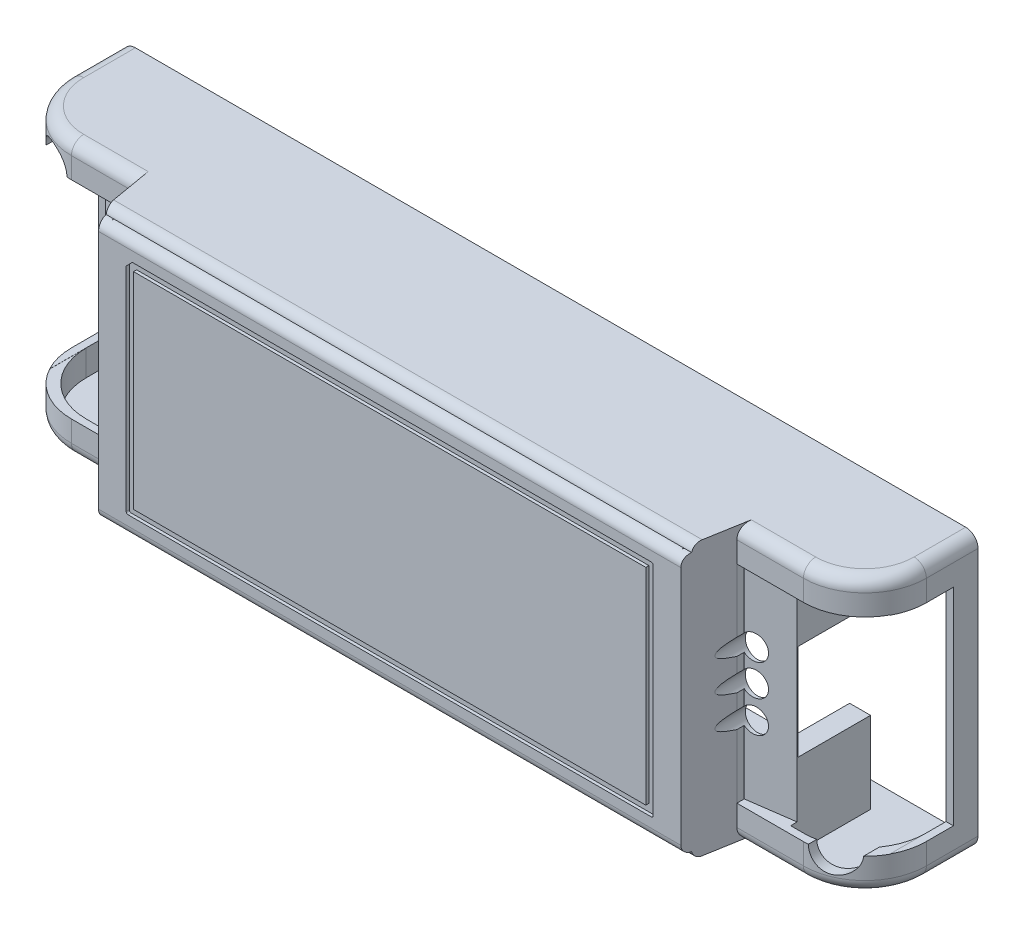
from build123d import *

# Parameters (mm, degrees)
SKETCH1_W           = 69.545
SKETCH1_H           = 44.53
BOSS_EXTRUDE1_DEPTH = 26.17
SKETCH2_W           = 20.83
SKETCH2_H           = 44.53
CUT_EXTRUDE1_DEPTH  = 7.77
CUT_EXTRUDE2_DEPTH  = 63.264890237
SKETCH4_W           = 49.937118806
SKETCH4_H           = 33.7
CUT_EXTRUDE3_DEPTH  = 1.2
SKETCH5_W           = 12.08
SKETCH5_H           = 33.7
CUT_EXTRUDE4_DEPTH  = 46.204169954
SKETCH6_W           = 6.22
SKETCH6_H           = 33.63
CUT_EXTRUDE5_DEPTH  = 1.2
SKETCH8_W           = 8.18
SKETCH8_H           = 33.63
CUT_EXTRUDE6_DEPTH  = 1.2
SKETCH9_W           = 4.2
SKETCH9_H           = 33.7
CUT_EXTRUDE7_DEPTH  = 5
SKETCH11_W          = 11.8
SKETCH11_H          = 15.6
CUT_EXTRUDE8_DEPTH  = 5
CUT_EXTRUDE9_DEPTH  = 4.2
CUT_EXTRUDE10_DEPTH = 4.2
SHELL3_START        = -21.065
SHELL3_DEPTH        = 42.13
SHELL3_2_OUTLINE_W  = 5
SHELL3_2_OUTLINE_H  = 10.6
SHELL3_2_DEPTH      = 12.08
SHELL3_START_2      = 9.015
SHELL3_3_OUTLINE_W  = 5
SHELL3_3_OUTLINE_H  = 10.6
SHELL3_3_DEPTH      = 12.05
SHELL3_4_DEPTH      = 3.03
SHELL3_START_3      = 18.065
SHELL3_5_DEPTH      = 3
SKETCH15_W          = 24.97
SKETCH15_H          = 42.13
CUT_EXTRUDE11_DEPTH = 4.2
CUT_EXTRUDE12_DEPTH = 4.2
SKETCH18_W          = 5
SKETCH18_H          = 12.05
CUT_EXTRUDE13_DEPTH = 4.2
SKETCH19_W          = 46.355516444
SKETCH19_H          = 1.5
BOSS_EXTRUDE2_DEPTH = 2.5
SKETCH22_W          = 49.678335722
SKETCH22_H          = 1.2
CUT_EXTRUDE16_DEPTH = 1.5
SKETCH23_W          = 1.5
SKETCH23_H          = 1.2
CUT_EXTRUDE17_DEPTH = 1.5
SKETCH24_W          = 47.365
SKETCH24_H          = 1.2
CUT_EXTRUDE18_DEPTH = 1.5
SKETCH25_W          = 1.5
SKETCH25_H          = 1.2
CUT_EXTRUDE19_DEPTH = 1.5
CUT_EXTRUDE20_DEPTH = 0.5
FILLET1_R           = 1.5
FILLET5_R           = 10
FILLET6_R           = 10
FILLET7_R           = 2
SKETCH27_W          = 3.013383432
SKETCH27_H          = 1.2
CUT_EXTRUDE21_DEPTH = 11.8
SKETCH28_W          = 2.79766396
SKETCH28_H          = 1.2
CUT_EXTRUDE22_DEPTH = 11.8
SKETCH29_W          = 5.34766396
SKETCH29_H          = 15.645548361
CUT_EXTRUDE23_DEPTH = 0.5
SKETCH30_R          = 2
CUT_EXTRUDE24_DEPTH = 108.935726486
SKETCH31_W          = 5.563383432
SKETCH31_H          = 15.653597394
CUT_EXTRUDE25_DEPTH = 0.5
SKETCH32_R          = 2
CUT_EXTRUDE26_DEPTH = 108.935726486
CHAMFER2_SIZE       = 1
FILLET8_R           = 0.3
SKETCH33_R          = 3.09
CUT_EXTRUDE27_DEPTH = 109.242464182
SKETCH34_R          = 3.09
CUT_EXTRUDE28_DEPTH = 109.242464182
CHAMFER6_SIZE       = 7.5
CHAMFER6_SIZE_2     = 1.05405626
SKETCH35_W          = 6.5
SKETCH35_H          = 2
CUT_EXTRUDE29_DEPTH = 0.5
CHAMFER7_SIZE       = 0.5
CHAMFER8_SIZE       = 0.5


# Read off the part's stored shape, not the designer's step: Shell3
# Some blends are built 0.0001 mm under size
with BuildPart() as part:
    # Sketch1 → Boss-Extrude1 (new body)
    with BuildSketch(Plane.XY):
        Rectangle(SKETCH1_W, SKETCH1_H)
    extrude(amount=BOSS_EXTRUDE1_DEPTH)

    # Sketch2 → Cut-Extrude1 (cut)
    with BuildSketch(Plane.XY.offset(26.17)):
        with Locations((24.3575, 0)):
            Rectangle(SKETCH2_W, SKETCH2_H)
    extrude(amount=-CUT_EXTRUDE1_DEPTH, mode=Mode.SUBTRACT)

    # Sketch3 → Cut-Extrude2 (cut, through all)
    with BuildSketch(Plane.XZ.offset(22.265)):
        Polygon((13.9425, 18.4), (13.9425, 26.17), (12.5925, 26.17), align=None)
    extrude(amount=-CUT_EXTRUDE2_DEPTH, mode=Mode.SUBTRACT)

    # Sketch4 → Cut-Extrude3 (cut)
    with BuildSketch(Plane.XY.offset(18.4)):
        with Locations((38.911059403, 0.015)):
            Rectangle(SKETCH4_W, SKETCH4_H)
    extrude(amount=-CUT_EXTRUDE3_DEPTH, mode=Mode.SUBTRACT)

    # Sketch5 → Cut-Extrude4 (cut, through all)
    with BuildSketch(Plane.XY.offset(18.4)):
        with Locations((27.5325, 0.015)):
            Rectangle(SKETCH5_W, SKETCH5_H)
    extrude(amount=-CUT_EXTRUDE4_DEPTH, mode=Mode.SUBTRACT)

    # Sketch6 → Cut-Extrude5 (cut)
    with BuildSketch(Plane(origin=(34.7725, 0, 0), x_dir=(0, 0, -1), z_dir=(1, 0, 0))):
        with Locations((-7.11, 0)):
            Rectangle(SKETCH6_W, SKETCH6_H)
    extrude(amount=-CUT_EXTRUDE5_DEPTH, mode=Mode.SUBTRACT)

    # Sketch8 → Cut-Extrude6 (cut)
    with BuildSketch(Plane(origin=(34.7725, 0, 0), x_dir=(0, 0, -1), z_dir=(1, 0, 0))):
        with Locations((-14.31, 0)):
            Rectangle(SKETCH8_W, SKETCH8_H)
    extrude(amount=-CUT_EXTRUDE6_DEPTH, mode=Mode.SUBTRACT)

    # Sketch9 → Cut-Extrude7 (cut)
    with BuildSketch(Plane(origin=(21.4925, 0, 0), x_dir=(0, 0, -1), z_dir=(1, 0, 0))):
        with Locations((-2.1, 0.015)):
            Rectangle(SKETCH9_W, SKETCH9_H)
    extrude(amount=-CUT_EXTRUDE7_DEPTH, mode=Mode.SUBTRACT)

    # Sketch11 → Cut-Extrude8 (cut)
    with BuildSketch(Plane(origin=(21.4925, 0, 0), x_dir=(0, 0, -1), z_dir=(1, 0, 0))):
        with Locations((-10.1, 0.015)):
            Rectangle(SKETCH11_W, SKETCH11_H)
    extrude(amount=-CUT_EXTRUDE8_DEPTH, mode=Mode.SUBTRACT)

    # Sketch13 → Cut-Extrude9 (cut)
    with BuildSketch(Plane.XZ.offset(-16.865)):
        Polygon((33.5725, 17.2), (21.4925, 17.2), (21.4925, 4.2), (16.4925, 4.2), (16.4925, 0), (33.5725, 0), align=None)
    extrude(amount=-CUT_EXTRUDE9_DEPTH, mode=Mode.SUBTRACT)

    # Sketch14 → Cut-Extrude10 (cut)
    with BuildSketch(Plane(origin=(0, -16.835, 0), x_dir=(1, 0, 0), z_dir=(0, 1, 0))):
        Polygon((33.5725, -17.2), (21.4925, -17.2), (21.4925, -4.2), (16.4925, -4.2), (16.4925, 0), (33.5725, 0), align=None)
    extrude(amount=-CUT_EXTRUDE10_DEPTH, mode=Mode.SUBTRACT)

    # Shell3 outline → Shell3 (cut)
    with BuildSketch(Plane(origin=(0, 0, 0), x_dir=(1, 0, 0), z_dir=(0, 1, 0)).offset(SHELL3_START)):
        Polygon((12.7425, -16), (15.2925, -16), (15.2925, 0), (-33.5725, 0), (-33.5725, -24.97), (11.583016444, -24.97), (12.7425, -18.296527977), align=None)
    extrude(amount=SHELL3_DEPTH, mode=Mode.SUBTRACT)

    # Shell3 2 outline → Shell3 2 (cut)
    with BuildSketch(Plane(origin=(0, 0, 0), x_dir=(1, 0, 0), z_dir=(0, 1, 0)).offset(SHELL3_START)):
        with Locations((17.7925, -10.7)):
            Rectangle(SHELL3_2_OUTLINE_W, SHELL3_2_OUTLINE_H)
    extrude(amount=SHELL3_2_DEPTH, mode=Mode.SUBTRACT)

    # Shell3 3 outline → Shell3 3 (cut)
    with BuildSketch(Plane(origin=(0, 0, 0), x_dir=(1, 0, 0), z_dir=(0, 1, 0)).offset(SHELL3_START_2)):
        with Locations((17.7925, -10.7)):
            Rectangle(SHELL3_3_OUTLINE_W, SHELL3_3_OUTLINE_H)
    extrude(amount=SHELL3_3_DEPTH, mode=Mode.SUBTRACT)

    # Shell3 4 outline → Shell3 4 (cut)
    with BuildSketch(Plane(origin=(0, 0, 0), x_dir=(1, 0, 0), z_dir=(0, 1, 0)).offset(SHELL3_START)):
        Polygon((20.2925, -17.2), (20.2925, -16), (12.7425, -16), (12.7425, -18.296527977), (12.933016444, -17.2), align=None)
    extrude(amount=SHELL3_4_DEPTH, mode=Mode.SUBTRACT)

    # Shell3 5 outline → Shell3 5 (cut)
    with BuildSketch(Plane(origin=(0, 0, 0), x_dir=(1, 0, 0), z_dir=(0, 1, 0)).offset(SHELL3_START_3)):
        Polygon((20.2925, -17.2), (20.2925, -16), (12.7425, -16), (12.7425, -18.296527977), (12.933016444, -17.2), align=None)
    extrude(amount=SHELL3_5_DEPTH, mode=Mode.SUBTRACT)

    # Sketch15 → Cut-Extrude11 (cut)
    with BuildSketch(Plane.ZY.offset(34.7725)):
        with Locations((12.485, 0)):
            Rectangle(SKETCH15_W, SKETCH15_H)
    extrude(amount=-CUT_EXTRUDE11_DEPTH, mode=Mode.SUBTRACT)

    # Sketch16 → Cut-Extrude12 (cut)
    with BuildSketch(Plane(origin=(16.4925, 0, 0), x_dir=(0, 0, -1), z_dir=(1, 0, 0))):
        Polygon((-16, -7.785), (-4.2, -7.785), (-4.2, -21.035), (0, -21.035), (0, 21.065), (-4.2, 21.065), (-4.2, 7.815), (-16, 7.815), align=None)
    extrude(amount=-CUT_EXTRUDE12_DEPTH, mode=Mode.SUBTRACT)

    # Sketch18 → Cut-Extrude13 (cut)
    with BuildSketch(Plane(origin=(0, 0, 4.2), x_dir=(-1, 0, 0), z_dir=(0, 0, -1))):
        with Locations((-17.7925, 15.04)):
            Rectangle(SKETCH18_W, SKETCH18_H)
        with Locations((-17.7925, -15.01)):
            Rectangle(SKETCH18_W, SKETCH18_H)
    extrude(amount=-CUT_EXTRUDE13_DEPTH, mode=Mode.SUBTRACT)

    # Sketch19 → Boss-Extrude2 (add)
    with BuildSketch(Plane(origin=(0, 0, 24.97), x_dir=(-1, 0, 0), z_dir=(0, 0, -1))):
        with Locations((11.594741778, -20.315)):
            Rectangle(SKETCH19_W, SKETCH19_H)
        with Locations((11.594741778, 20.315)):
            Rectangle(SKETCH19_W, SKETCH19_H)
    extrude(amount=BOSS_EXTRUDE2_DEPTH)

    # Sketch22 → Cut-Extrude16 (cut)
    with BuildSketch(Plane.XY.offset(26.17)):
        with Locations((-12.246667861, -21.665)):
            Rectangle(SKETCH22_W, SKETCH22_H)
    extrude(amount=-CUT_EXTRUDE16_DEPTH, mode=Mode.SUBTRACT)

    # Sketch23 → Cut-Extrude17 (cut)
    with BuildSketch(Plane.ZY.offset(-12.5925)):
        with Locations((25.42, -21.665)):
            Rectangle(SKETCH23_W, SKETCH23_H)
    extrude(amount=-CUT_EXTRUDE17_DEPTH, mode=Mode.SUBTRACT)

    # Sketch24 → Cut-Extrude18 (cut)
    with BuildSketch(Plane.XY.offset(26.17)):
        with Locations((-11.09, 21.665)):
            Rectangle(SKETCH24_W, SKETCH24_H)
    extrude(amount=-CUT_EXTRUDE18_DEPTH, mode=Mode.SUBTRACT)

    # Sketch25 → Cut-Extrude19 (cut)
    with BuildSketch(Plane.ZY.offset(-12.5925)):
        with Locations((25.42, 21.665)):
            Rectangle(SKETCH25_W, SKETCH25_H)
    extrude(amount=-CUT_EXTRUDE19_DEPTH, mode=Mode.SUBTRACT)

    # Sketch26 → Cut-Extrude20 (cut)
    with BuildSketch(Plane.XY.offset(26.17)):
        Polygon((8.0925, -17.955), (8.0925, 17.951908527), (-34.7725, 17.951908527), (-34.7725, 16.751908527), (6.8925, 16.751908527), (6.8925, -16.755), (-34.7725, -16.755), (-34.7725, -17.955), align=None)
    extrude(amount=-CUT_EXTRUDE20_DEPTH, mode=Mode.SUBTRACT)

    # Fillet1
    # the kernel refuses this fillet: 1.5 mm, written as the material it takes off along each edge
    with BuildSketch(Plane(origin=(16.3425, 21.065, 26.17), x_dir=(0, 0, -1), z_dir=(-1, 0, 0))) as fillet1_piece_1:
        with BuildLine():
            CenterArc((FILLET1_R, FILLET1_R), FILLET1_R, 180, 90)
            Line((0, FILLET1_R), (-FILLET1_R * 0.02, FILLET1_R))
            Line((-FILLET1_R * 0.02, FILLET1_R), (-FILLET1_R * 0.02, -FILLET1_R * 0.02))
            Line((-FILLET1_R * 0.02, -FILLET1_R * 0.02), (FILLET1_R, -FILLET1_R * 0.02))
            Line((FILLET1_R, -FILLET1_R * 0.02), (FILLET1_R, 0))
        make_face()
    extrude(amount=54.865, mode=Mode.SUBTRACT)
    with BuildSketch(Plane(origin=(-38.446734614, 22.265, 24.67), x_dir=(0, 0, -1), z_dir=(1, 0, 0)), Plane(origin=(16.527352375, -22.265, 24.67), x_dir=(0, 0, -1), z_dir=(-1, 0, 0))) as fillet1_piece_2:
        with BuildLine():
            CenterArc((1.469693846, -1.5), FILLET1_R, 90, 78.463040967)
            Line((0, -1.2), (-0.029393877, -1.194))
            ThreePointArc((-0.029393877, -1.194), (-0.03, -0.6), (-0.03, 0))
            Line((-0.03, 0), (0, 0.03))
            Line((0, 0.03), (1.469693846, 0.03))
            Line((1.469693846, 0.03), (1.469693846, 0))
        make_face()
    extrude(amount=54.974086989, mode=Mode.SUBTRACT)
    with BuildSketch(Plane(origin=(-38.5225, -21.065, 26.17), x_dir=(0, 1, 0), z_dir=(1, 0, 0))) as fillet1_piece_3:
        with BuildLine():
            CenterArc((FILLET1_R, -FILLET1_R), FILLET1_R, 90, 90)
            Line((0, -FILLET1_R), (-FILLET1_R * 0.02, -FILLET1_R))
            Line((-FILLET1_R * 0.02, -FILLET1_R), (-FILLET1_R * 0.02, FILLET1_R * 0.02))
            Line((-FILLET1_R * 0.02, FILLET1_R * 0.02), (FILLET1_R, FILLET1_R * 0.02))
            Line((FILLET1_R, FILLET1_R * 0.02), (FILLET1_R, 0))
        make_face()
    extrude(amount=54.865, mode=Mode.SUBTRACT)

    # Fillet5
    fillet5_edges = [part.edges().sort_by_distance(p)[0] for p in [
        (33.5725, 18.965, 17.2),
        (33.5725, -18.935, 17.2),
    ]]
    fillet(fillet5_edges, radius=FILLET5_R)

    # Fillet6
    # the kernel refuses this fillet: 10 mm, written as the material it takes off along each edge
    with BuildSketch(Plane(origin=(34.7725, -47.265, 18.4), x_dir=(0, 0, -1), z_dir=(0, 1, 0))) as fillet6_piece_1:
        with BuildLine():
            CenterArc((FILLET6_R, FILLET6_R), FILLET6_R, 180, 90)
            Line((0, FILLET6_R), (0, 0))
            Line((0, 0), (FILLET6_R, 0))
        make_face()
    extrude(amount=55.43, mode=Mode.SUBTRACT)
    with BuildSketch(Plane(origin=(34.7725, -8.135, 18.4), x_dir=(0, 0, -1), z_dir=(0, 1, 0))) as fillet6_piece_2:
        with BuildLine():
            CenterArc((FILLET6_R, FILLET6_R), FILLET6_R, 180, 90)
            Line((0, FILLET6_R), (0, 0))
            Line((0, 0), (FILLET6_R, 0))
        make_face()
    extrude(amount=55.4, mode=Mode.SUBTRACT)

    # Fillet7
    fillet7_edges = [part.edges().sort_by_distance(p)[0] for p in [
        (19.3575, -22.265, 18.4),
        (34.7725, -22.265, 4.2),
        (34.7725, 22.265, 4.2),
        (31.843567812, -22.265, 15.471067812),
        (19.3575, 22.265, 18.4),
        (31.843567812, 22.265, 15.471067812),
    ]]
    fillet(fillet7_edges, radius=FILLET7_R)

    # Mirror1: part across plane


with BuildPart() as part_1:
    add(part.part)
    add(part.part.mirror(Plane(origin=(-34.7725, 22.265, 26.17), x_dir=(0, 0, 1), z_dir=(1, 0, 0))))

    # Sketch27 → Cut-Extrude21 (cut)
    with BuildSketch(Plane(origin=(0, 0, 4.2), x_dir=(-1, 0, 0), z_dir=(0, 0, -1))):
        with Locations((86.344191716, 8.415)):
            Rectangle(SKETCH27_W, SKETCH27_H)
        with Locations((86.344191716, -8.385)):
            Rectangle(SKETCH27_W, SKETCH27_H)
    extrude(amount=-CUT_EXTRUDE21_DEPTH, mode=Mode.SUBTRACT)

    # Sketch28 → Cut-Extrude22 (cut)
    with BuildSketch(Plane(origin=(0, 0, 4.2), x_dir=(-1, 0, 0), z_dir=(0, 0, -1))):
        with Locations((-16.69133198, -8.385)):
            Rectangle(SKETCH28_W, SKETCH28_H)
        with Locations((-16.69133198, 8.415)):
            Rectangle(SKETCH28_W, SKETCH28_H)
    extrude(amount=-CUT_EXTRUDE22_DEPTH, mode=Mode.SUBTRACT)

    # Sketch29 → Cut-Extrude23 (cut)
    with BuildSketch(Plane(origin=(0, 0, 16), x_dir=(-1, 0, 0), z_dir=(0, 0, -1))):
        with Locations((-15.41633198, 0.037774181)):
            Rectangle(SKETCH29_W, SKETCH29_H)
    extrude(amount=-CUT_EXTRUDE23_DEPTH, mode=Mode.SUBTRACT)

    # Sketch30 → Cut-Extrude24 (cut, through all)
    with BuildSketch(Plane(origin=(0, 0, 16.5), x_dir=(-1, 0, 0), z_dir=(0, 0, -1))):
        with Locations((-15.4125, -5.115)):
            Circle(SKETCH30_R)
        with Locations((-15.4125, 0.060548361)):
            Circle(SKETCH30_R)
        with Locations((-15.4125, 5.190548361)):
            Circle(SKETCH30_R)
    extrude(amount=-CUT_EXTRUDE24_DEPTH, mode=Mode.SUBTRACT)

    # Sketch31 → Cut-Extrude25 (cut)
    with BuildSketch(Plane(origin=(0, 0, 16), x_dir=(-1, 0, 0), z_dir=(0, 0, -1))):
        with Locations((85.069191716, 0.041798697)):
            Rectangle(SKETCH31_W, SKETCH31_H)
    extrude(amount=-CUT_EXTRUDE25_DEPTH, mode=Mode.SUBTRACT)

    # Sketch32 → Cut-Extrude26 (cut, through all)
    with BuildSketch(Plane(origin=(0, 0, 16.5), x_dir=(-1, 0, 0), z_dir=(0, 0, -1))):
        with Locations((84.990163266, -4.596818662)):
            Circle(SKETCH32_R)
        with Locations((84.990163266, 4.748597394)):
            Circle(SKETCH32_R)
    extrude(amount=-CUT_EXTRUDE26_DEPTH, mode=Mode.SUBTRACT)

    # Chamfer2
    chamfer2_edges = [part_1.edges().sort_by_distance(p)[0] for p in [
        (-77.6375, 17.951908527, 25.92),
    ]]
    chamfer(chamfer2_edges, length=CHAMFER2_SIZE)

    # Fillet8
    fillet8_edges = [part_1.edges().sort_by_distance(p)[0] for p in [
        (8.0925, 17.951908527, 25.92),
        (8.0925, -17.955, 25.92),
        (-77.6375, -17.955, 25.92),
    ]]
    fillet(fillet8_edges, radius=FILLET8_R)

    # Sketch33 → Cut-Extrude27 (cut, through all)
    with BuildSketch(Plane.XY.offset(18.4)):
        with Locations((-98.1775, 16.865)):
            Circle(SKETCH33_R)
    extrude(amount=-CUT_EXTRUDE27_DEPTH, mode=Mode.SUBTRACT)

    # Sketch34 → Cut-Extrude28 (cut, through all)
    with BuildSketch(Plane.XY.offset(18.4)):
        with Locations((28.6325, -16.835)):
            Circle(SKETCH34_R)
    extrude(amount=-CUT_EXTRUDE28_DEPTH, mode=Mode.SUBTRACT)

    # Chamfer5
    # the kernel refuses this chamfer: 7.5, 1.05405626 mm, written as the material it takes off along each edge
    with BuildSketch(Plane(origin=(21.4925, 16.865, 17.2), x_dir=(-0.9999856632816031, 0, 0.005354739139527623), z_dir=(0, -1, 0))) as chamfer5_piece_1_section:
        with BuildLine():
            Line((7.797192207, 0), (-0.302943928, 1.094201692))
            Line((-0.302943928, 1.094201692), (-0.452941778, 1.093398481))
            ThreePointArc((-0.452941778, 1.093398481), (-0.152931733, 0.547093029), (-0.149997849, -0.000803211))
            Line((-0.149997849, -0.000803211), (0.000803211, -0.149997849))
            ThreePointArc((0.000803211, -0.149997849), (3.899287529, -0.129122184), (7.797995418, -0.149997849))
            Line((7.797995418, -0.149997849), (7.797192207, 0))
        make_face()
    chamfer5_piece_1 = extrude(amount=33.7, mode=Mode.PRIVATE)
    chamfer5_piece_1 = split(chamfer5_piece_1, bisect_by=Plane(origin=(19.125053222, 0.015, 17.2), z_dir=(0, 0, -1)), keep=Keep.TOP, mode=Mode.PRIVATE)
    add(chamfer5_piece_1, mode=Mode.SUBTRACT)

    # Chamfer6
    # the kernel refuses this chamfer: 7.5, 1.05405626 mm, written as the material it takes off along each edge
    with BuildSketch(Plane(origin=(-91.0375, 16.865, 17.2), x_dir=(0.9999856632816031, 0, 0.005354739139527627), z_dir=(0, -1, 0))) as chamfer6_piece_1:
        Polygon((CHAMFER6_SIZE * 0.999985663282, -CHAMFER6_SIZE * 0.00535473913953), (-CHAMFER6_SIZE_2 * 0.00535473914089, -CHAMFER6_SIZE_2 * 0.999985663536), (0, 0), align=None)
    extrude(amount=33.7, mode=Mode.SUBTRACT)

    # Sketch35 → Cut-Extrude29 (cut)
    with BuildSketch(Plane.XZ.offset(-21.065)):
        with Locations((1.8425, 4)):
            Rectangle(SKETCH35_W, SKETCH35_H)
        with Locations((-71.5075, 4)):
            Rectangle(SKETCH35_W, SKETCH35_H)
    cut_extrude29 = extrude(amount=-CUT_EXTRUDE29_DEPTH, mode=Mode.SUBTRACT)

    # Chamfer7
    chamfer7_edges = [part_1.edges().sort_by_distance(p)[0] for p in [
        (-71.5075, 21.065, 5),
        (1.8425, 21.065, 5),
    ]]
    chamfer(chamfer7_edges, length=CHAMFER7_SIZE - 0.0001)  # a hair under: the kernel refuses the full size

    # Mirror4: Cut-Extrude29 across plane
    add(cut_extrude29.mirror(Plane.ZX), mode=Mode.SUBTRACT)

    # Chamfer8
    chamfer8_edges = [part_1.edges().sort_by_distance(p)[0] for p in [
        (-71.5075, -21.065, 5),
        (1.8425, -21.065, 5),
    ]]
    chamfer(chamfer8_edges, length=CHAMFER8_SIZE - 0.0001)  # a hair under: the kernel refuses the full size


solid = part_1.part
